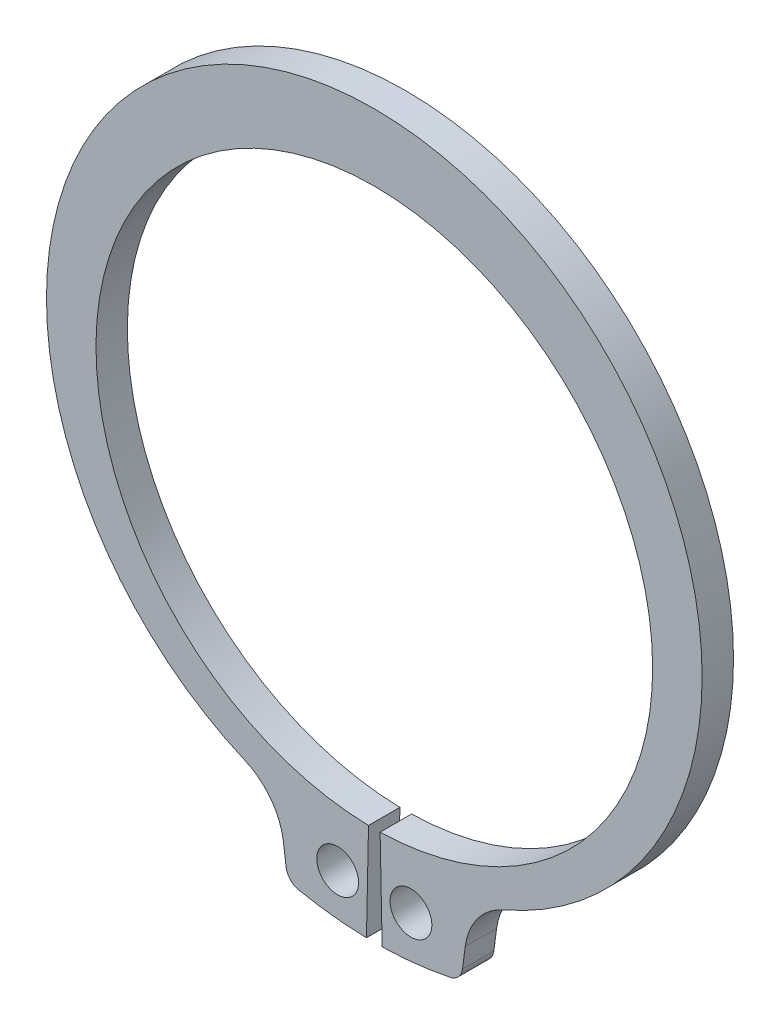
from build123d import *

# Parameters (mm, degrees)
BODYSKE_R  = 1
BODY_DEPTH = 1.5


with BuildPart() as part:
    # BodySke → Body (new body)
    with BuildSketch(Plane.XY):
        with BuildLine():
            Line((0.277083333, -13.297113402), (0.375, -17.996093326))
            ThreePointArc((0.375, -17.996093326), (2.006196266, -17.88784997), (3.620844399, -17.632058469))
            ThreePointArc((3.620844399, -17.632058469), (4.018958209, -17.408386826), (4.213559528, -16.99528401))
            Line((4.213559528, -16.99528401), (4.345136613, -15.995856825))
            ThreePointArc((4.345136613, -15.995856825), (4.946205729, -14.530545953), (6.192726344, -13.553506349))
            ThreePointArc((6.192726344, -13.553506349), (0, 16.5), (-6.192726344, -13.553506349))
            ThreePointArc((-6.192726344, -13.553506349), (-4.946205729, -14.530545953), (-4.345136613, -15.995856825))
            Line((-4.345136613, -15.995856825), (-4.213559528, -16.99528401))
            ThreePointArc((-4.213559528, -16.99528401), (-4.018958209, -17.408386826), (-3.620844399, -17.632058469))
            ThreePointArc((-3.620844399, -17.632058469), (-2.006196266, -17.88784997), (-0.375, -17.996093326))
            Line((-0.375, -17.996093326), (-0.277083333, -13.297113402))
            ThreePointArc((-0.277083333, -13.297113402), (0, 13.3), (0.277083333, -13.297113402))
        make_face()
        with Locations((1.75, -15.904008929)):
            Circle(BODYSKE_R, mode=Mode.SUBTRACT)
        with Locations((-1.75, -15.904008929)):
            Circle(BODYSKE_R, mode=Mode.SUBTRACT)
    extrude(amount=-BODY_DEPTH)


solid = part.part
